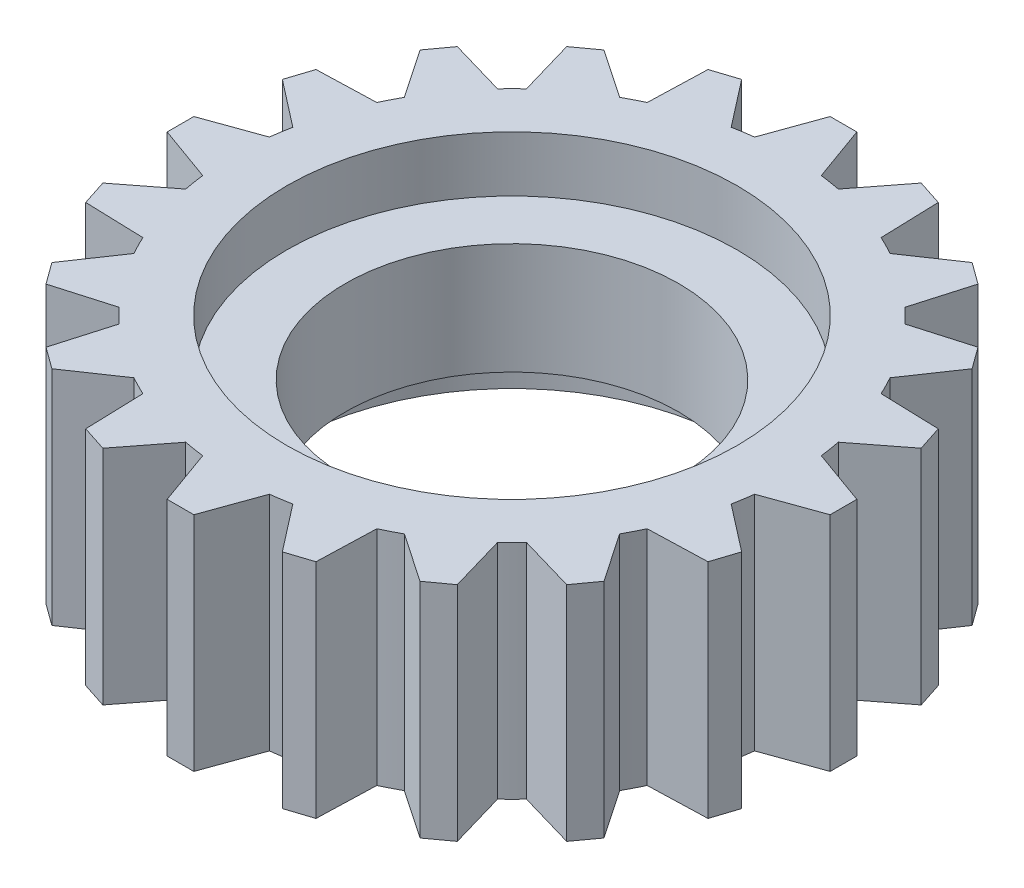
from build123d import *

# Parameters (mm, degrees)
BOSS_EXTRUDE2_START     = -10
BOSS_EXTRUDE2_DEPTH     = 20
CUT_EXTRUDE1_DEPTH      = 5
CUT_EXTRUDE1_DEPTH_BACK = 5
SKETCH3_R               = 15
SKETCH4_R               = 20.25
CUT_EXTRUDE2_DEPTH      = 5


# Read off the part's stored shape, not the designer's step: Boss-Extrude2
with BuildPart() as part:
    # Boss-Extrude2 outline → Boss-Extrude2 (new body)
    with BuildSketch(Plane(origin=(0, 0, 0), x_dir=(1, 0, 0), z_dir=(0, 1, 0)).offset(BOSS_EXTRUDE2_START)):
        with BuildLine():
            Line((24.819347292, -3), (29.819347292, -1.2))
            Line((29.819347292, -1.2), (29.819347292, 1.2))
            Line((29.819347292, 1.2), (24.819347292, 3))
            ThreePointArc((24.819347292, 3), (24.692232517, 3.910710079), (24.531712075, 4.81612943))
            Line((24.531712075, 4.81612943), (28.73075389, 8.073108238))
            Line((28.73075389, 8.073108238), (27.989113104, 10.355643877))
            Line((27.989113104, 10.355643877), (22.677695772, 10.522457624))
            ThreePointArc((22.677695772, 10.522457624), (22.275365258, 11.349365736), (21.842895395, 12.160917759))
            Line((21.842895395, 12.160917759), (24.829892006, 16.555964393))
            Line((24.829892006, 16.555964393), (23.419207401, 18.497605179))
            Line((23.419207401, 18.497605179), (18.316388565, 17.014990742))
            ThreePointArc((18.316388565, 17.014990742), (17.678159939, 17.677179107), (17.016006986, 18.315444473))
            Line((17.016006986, 18.315444473), (18.498605179, 23.418207401))
            Line((18.498605179, 23.418207401), (16.556964393, 24.828892006))
            Line((16.556964393, 24.828892006), (12.162276227, 21.84213902))
            ThreePointArc((12.162276227, 21.84213902), (11.350541159, 22.274766338), (10.523440542, 22.677239672))
            Line((10.523440542, 22.677239672), (10.356643877, 27.988113104))
            Line((10.356643877, 27.988113104), (8.074108238, 28.72975389))
            Line((8.074108238, 28.72975389), (4.817670386, 24.5314095))
            ThreePointArc((4.817670386, 24.5314095), (3.911818446, 24.69205695), (3.00066912, 24.819266404))
            Line((3.00066912, 24.819266404), (1.201, 29.818347292))
            Line((1.201, 29.818347292), (-1.199, 29.818347292))
            Line((-1.199, 29.818347292), (-2.998578144, 24.819519115))
            ThreePointArc((-2.998578144, 24.819519115), (-3.909904803, 24.692360042), (-4.815934726, 24.531750299))
            Line((-4.815934726, 24.531750299), (-8.072108238, 28.72975389))
            Line((-8.072108238, 28.72975389), (-10.354643877, 27.988113104))
            Line((-10.354643877, 27.988113104), (-10.521410966, 22.678181393))
            ThreePointArc((-10.521410966, 22.678181393), (-11.348983821, 22.275559841), (-12.16117688, 21.842751129))
            Line((-12.16117688, 21.842751129), (-16.554964393, 24.828892006))
            Line((-16.554964393, 24.828892006), (-18.496605179, 23.418207401))
            Line((-18.496605179, 23.418207401), (-17.014432073, 18.316907524))
            ThreePointArc((-17.014432073, 18.316907524), (-17.677179115, 17.678159931), (-18.315963478, 17.01544833))
            Line((-18.315963478, 17.01544833), (-23.417207401, 18.497605179))
            Line((-23.417207401, 18.497605179), (-24.827892006, 16.555964393))
            Line((-24.827892006, 16.555964393), (-21.841994742, 12.162535331))
            ThreePointArc((-21.841994742, 12.162535331), (-22.274960948, 11.350159239), (-22.677725349, 10.522393882))
            Line((-22.677725349, 10.522393882), (-27.987113104, 10.355643877))
            Line((-27.987113104, 10.355643877), (-28.72875389, 8.073108238))
            Line((-28.72875389, 8.073108238), (-24.531447735, 4.817475691))
            ThreePointArc((-24.531447735, 4.817475691), (-24.692184512, 3.91101317), (-24.819438268, 2.999247249))
            Line((-24.819438268, 2.999247249), (-29.817347292, 1.2))
            Line((-29.817347292, 1.2), (-29.817347292, -1.2))
            Line((-29.817347292, -1.2), (-24.819438268, -2.999247249))
            ThreePointArc((-24.819438268, -2.999247249), (-24.692184512, -3.91101317), (-24.531447735, -4.817475691))
            Line((-24.531447735, -4.817475691), (-28.72875389, -8.073108238))
            Line((-28.72875389, -8.073108238), (-27.987113104, -10.355643877))
            Line((-27.987113104, -10.355643877), (-22.677725349, -10.522393882))
            ThreePointArc((-22.677725349, -10.522393882), (-22.274960948, -11.350159239), (-21.841994742, -12.162535331))
            Line((-21.841994742, -12.162535331), (-24.827892006, -16.555964393))
            Line((-24.827892006, -16.555964393), (-23.417207401, -18.497605179))
            Line((-23.417207401, -18.497605179), (-18.315963478, -17.01544833))
            ThreePointArc((-18.315963478, -17.01544833), (-17.677179115, -17.678159931), (-17.014432073, -18.316907524))
            Line((-17.014432073, -18.316907524), (-18.496605179, -23.418207401))
            Line((-18.496605179, -23.418207401), (-16.554964393, -24.828892006))
            Line((-16.554964393, -24.828892006), (-12.16117688, -21.842751129))
            ThreePointArc((-12.16117688, -21.842751129), (-11.348983821, -22.275559841), (-10.521410966, -22.678181393))
            Line((-10.521410966, -22.678181393), (-10.354643877, -27.988113104))
            Line((-10.354643877, -27.988113104), (-8.072108238, -28.72975389))
            Line((-8.072108238, -28.72975389), (-4.815934726, -24.531750299))
            ThreePointArc((-4.815934726, -24.531750299), (-3.909904803, -24.692360042), (-2.998578144, -24.819519115))
            Line((-2.998578144, -24.819519115), (-1.199, -29.818347292))
            Line((-1.199, -29.818347292), (1.201, -29.818347292))
            Line((1.201, -29.818347292), (3.00066912, -24.819266404))
            ThreePointArc((3.00066912, -24.819266404), (3.911818446, -24.69205695), (4.817670386, -24.5314095))
            Line((4.817670386, -24.5314095), (8.074108238, -28.72975389))
            Line((8.074108238, -28.72975389), (10.356643877, -27.988113104))
            Line((10.356643877, -27.988113104), (10.523440542, -22.677239672))
            ThreePointArc((10.523440542, -22.677239672), (11.350541159, -22.274766338), (12.162276227, -21.84213902))
            Line((12.162276227, -21.84213902), (16.556964393, -24.828892006))
            Line((16.556964393, -24.828892006), (18.498605179, -23.418207401))
            Line((18.498605179, -23.418207401), (17.016006986, -18.315444473))
            ThreePointArc((17.016006986, -18.315444473), (17.678159939, -17.677179107), (18.316388565, -17.014990742))
            Line((18.316388565, -17.014990742), (23.419207401, -18.497605179))
            Line((23.419207401, -18.497605179), (24.829892006, -16.555964393))
            Line((24.829892006, -16.555964393), (21.842895395, -12.160917759))
            ThreePointArc((21.842895395, -12.160917759), (22.275365258, -11.349365736), (22.677695772, -10.522457624))
            Line((22.677695772, -10.522457624), (27.989113104, -10.355643877))
            Line((27.989113104, -10.355643877), (28.73075389, -8.073108238))
            Line((28.73075389, -8.073108238), (24.531712075, -4.81612943))
            ThreePointArc((24.531712075, -4.81612943), (24.692232517, -3.910710079), (24.819347292, -3))
        make_face()
    extrude(amount=BOSS_EXTRUDE2_DEPTH)

    # Sketch3 → Cut-Extrude1 (cut, two sides: drawn at the far end of the back side and taken through both)
    with BuildSketch(Plane(origin=(0, 0, 0), x_dir=(1, 0, 0), z_dir=(0, 1, 0)).offset(-CUT_EXTRUDE1_DEPTH_BACK)):
        with Locations(Location((0, 0, 0), (0, 0, 270))):
            Circle(SKETCH3_R)
    extrude(amount=CUT_EXTRUDE1_DEPTH + CUT_EXTRUDE1_DEPTH_BACK, mode=Mode.SUBTRACT)

    # Sketch4 → Cut-Extrude2 (cut)
    with BuildSketch(Plane(origin=(0, 10, 0), x_dir=(1, 0, 0), z_dir=(0, 1, 0))):
        with Locations(Location((0, 0, 0), (0, 0, 270))):
            Circle(SKETCH4_R)
    cut_extrude2 = extrude(amount=-CUT_EXTRUDE2_DEPTH, mode=Mode.SUBTRACT)

    # Mirror1: Cut-Extrude2 across plane
    add(cut_extrude2.mirror(Plane.ZX), mode=Mode.SUBTRACT)


solid = part.part
